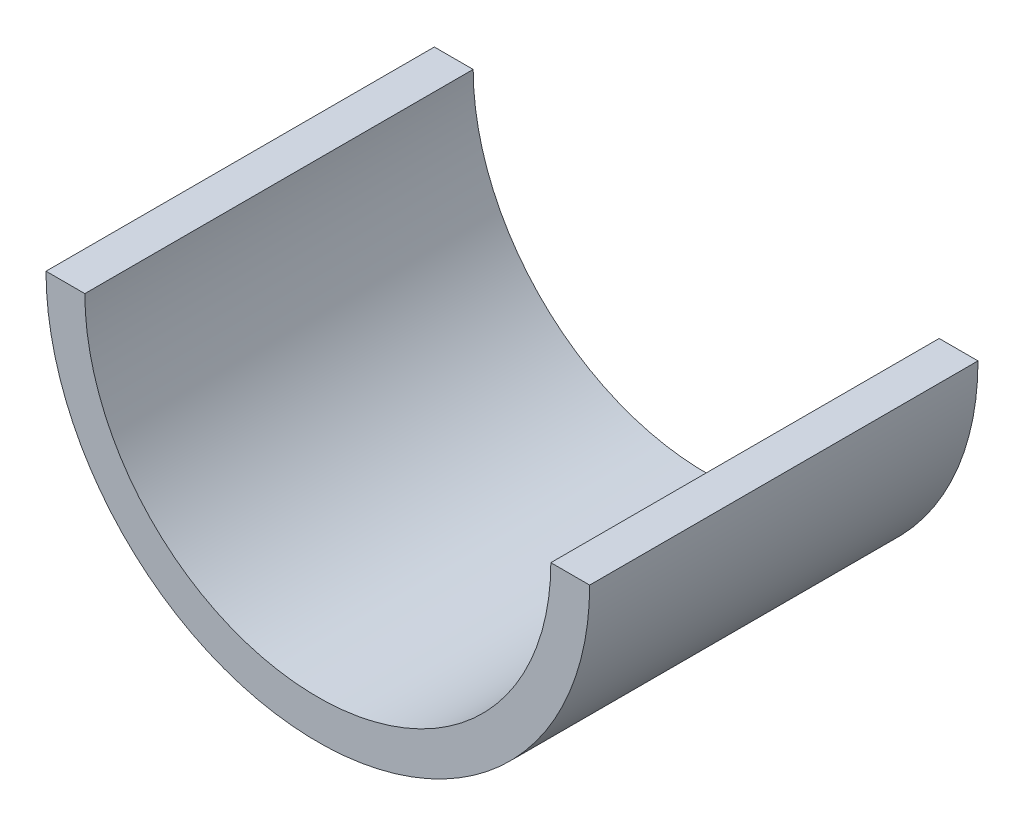
from build123d import *

# Parameters (mm, degrees)
EXTRUDE_1_DEPTH = 50


with BuildPart() as part:
    # Эскиз1 → Бобышка-Вытянуть1 (new body)
    with BuildSketch(Plane.XY):
        with BuildLine():
            Line((-30, 0), (-35, 0))
            ThreePointArc((-35, 0), (0, -35), (35, 0))
            Line((35, 0), (30, 0))
            ThreePointArc((30, 0), (0, -30), (-30, 0))
        make_face()
    extrude(amount=EXTRUDE_1_DEPTH)


solid = part.part
